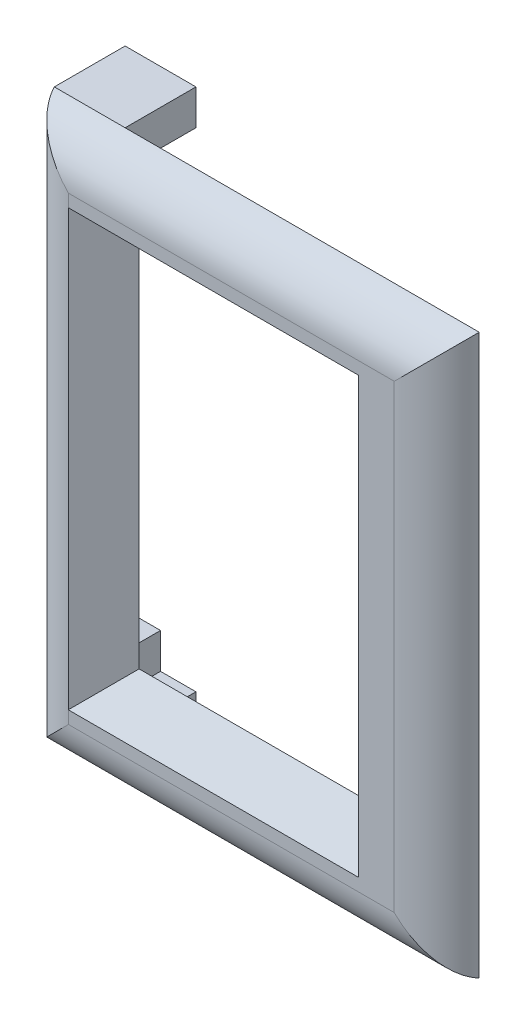
from build123d import *

# Parameters (mm, degrees)
SKETCH1_W           = 30
SKETCH1_H           = 39.485211854
BOSS_EXTRUDE1_DEPTH = 2.5
SKETCH2_W           = 14.50000216
SKETCH2_H           = 24.699998732
CUT_EXTRUDE1_DEPTH  = 37.000350752
CHAMFER2_SIZE       = 3
FILLET5_R           = 3.7
BOSS_EXTRUDE2_DEPTH = 5


with BuildPart() as part:
    # Sketch1 → Boss-Extrude1 (new body)
    with BuildSketch(Plane.XY):
        with Locations((15.000000036, -0.000120634)):
            Rectangle(SKETCH1_W, SKETCH1_H)
    extrude(amount=BOSS_EXTRUDE1_DEPTH)

    # Sketch2 → Cut-Extrude1 (cut, through all)
    with BuildSketch(Plane.XY.offset(2.5)):
        with Locations((13.737600789, -1.949e-06)):
            Rectangle(SKETCH2_W, SKETCH2_H)
    extrude(amount=-CUT_EXTRUDE1_DEPTH, mode=Mode.SUBTRACT)

    # Chamfer2
    # the kernel refuses this chamfer: 3 mm, written as the material it takes off along each edge
    with BuildSketch(Plane(origin=(20.987601869, -12.350001315, 2.5), x_dir=(0, -1, 0), z_dir=(-1, 0, 0)), Plane(origin=(6.487599709, 12.349997417, 2.5), x_dir=(0, 1, 0), z_dir=(1, 0, 0))) as chamfer2_piece_1:
        Polygon((CHAMFER2_SIZE, 0), (0, -CHAMFER2_SIZE), (0, 0), align=None)
    extrude(amount=14.500002159, mode=Mode.SUBTRACT)
    with BuildSketch(Plane(origin=(20.987601869, 12.349997417, 2.5), x_dir=(1, 0, 0), z_dir=(0, -1, 0)), Plane(origin=(6.487599709, -12.350001315, 2.5), x_dir=(-1, 0, 0), z_dir=(0, 1, 0))) as chamfer2_piece_2:
        Polygon((CHAMFER2_SIZE, 0), (0, -CHAMFER2_SIZE), (0, 0), align=None)
    extrude(amount=24.699998732, mode=Mode.SUBTRACT)
    with BuildSketch(Plane(origin=(20.987601869, 12.349997417, 2.5), x_dir=(1, 0, 0), z_dir=(0, -1, 0))) as chamfer2_piece_3a_section:
        Polygon((CHAMFER2_SIZE, 0), (0, -CHAMFER2_SIZE), (0, 0), align=None)
    chamfer2_piece_3a = extrude(amount=32.415047696, mode=Mode.PRIVATE)
    chamfer2_piece_3a = split(chamfer2_piece_3a, bisect_by=Plane(origin=(20.987601869, -12.350001315, 2.5), z_dir=(0, -1, 0)), keep=Keep.TOP, mode=Mode.PRIVATE)
    with BuildSketch(Plane(origin=(28.702650833, -12.350001315, 2.5), x_dir=(0, -1, 0), z_dir=(-1, 0, 0))) as chamfer2_piece_3b_section:
        Polygon((CHAMFER2_SIZE, 0), (0, -CHAMFER2_SIZE), (0, 0), align=None)
    chamfer2_piece_3b = extrude(amount=22.215051123, mode=Mode.PRIVATE)
    chamfer2_piece_3b = split(chamfer2_piece_3b, bisect_by=Plane(origin=(20.987601869, -12.350001315, 2.5), z_dir=(1, 0, 0)), keep=Keep.TOP, mode=Mode.PRIVATE)
    chamfer2_piece_3 = chamfer2_piece_3a & chamfer2_piece_3b
    add(chamfer2_piece_3, mode=Mode.SUBTRACT)
    with BuildSketch(Plane(origin=(20.987601869, -12.350001315, 2.5), x_dir=(0, -1, 0), z_dir=(-1, 0, 0))) as chamfer2_piece_4a_section:
        Polygon((CHAMFER2_SIZE, 0), (0, -CHAMFER2_SIZE), (0, 0), align=None)
    chamfer2_piece_4a = extrude(amount=22.215051123, mode=Mode.PRIVATE)
    chamfer2_piece_4a = split(chamfer2_piece_4a, bisect_by=Plane(origin=(6.487599709, -12.350001315, 2.5), z_dir=(-1, 0, 0)), keep=Keep.TOP, mode=Mode.PRIVATE)
    with BuildSketch(Plane(origin=(6.487599709, -20.065050279, 2.5), x_dir=(-1, 0, 0), z_dir=(0, 1, 0))) as chamfer2_piece_4b_section:
        Polygon((CHAMFER2_SIZE, 0), (0, -CHAMFER2_SIZE), (0, 0), align=None)
    chamfer2_piece_4b = extrude(amount=32.415047696, mode=Mode.PRIVATE)
    chamfer2_piece_4b = split(chamfer2_piece_4b, bisect_by=Plane(origin=(6.487599709, -12.350001315, 2.5), z_dir=(0, -1, 0)), keep=Keep.TOP, mode=Mode.PRIVATE)
    chamfer2_piece_4 = chamfer2_piece_4a & chamfer2_piece_4b
    add(chamfer2_piece_4, mode=Mode.SUBTRACT)
    with BuildSketch(Plane(origin=(6.487599709, 12.349997417, 2.5), x_dir=(0, 1, 0), z_dir=(1, 0, 0))) as chamfer2_piece_5a_section:
        Polygon((CHAMFER2_SIZE, 0), (0, -CHAMFER2_SIZE), (0, 0), align=None)
    chamfer2_piece_5a = extrude(amount=22.215051123, mode=Mode.PRIVATE)
    chamfer2_piece_5a = split(chamfer2_piece_5a, bisect_by=Plane(origin=(20.987601869, 12.349997417, 2.5), z_dir=(1, 0, 0)), keep=Keep.TOP, mode=Mode.PRIVATE)
    with BuildSketch(Plane(origin=(20.987601869, 20.065046381, 2.5), x_dir=(1, 0, 0), z_dir=(0, -1, 0))) as chamfer2_piece_5b_section:
        Polygon((CHAMFER2_SIZE, 0), (0, -CHAMFER2_SIZE), (0, 0), align=None)
    chamfer2_piece_5b = extrude(amount=32.415047696, mode=Mode.PRIVATE)
    chamfer2_piece_5b = split(chamfer2_piece_5b, bisect_by=Plane(origin=(20.987601869, 12.349997417, 2.5), z_dir=(0, 1, 0)), keep=Keep.TOP, mode=Mode.PRIVATE)
    chamfer2_piece_5 = chamfer2_piece_5a & chamfer2_piece_5b
    add(chamfer2_piece_5, mode=Mode.SUBTRACT)
    with BuildSketch(Plane(origin=(-1.227449254, 12.349997417, 2.5), x_dir=(0, 1, 0), z_dir=(1, 0, 0))) as chamfer2_piece_6a_section:
        Polygon((CHAMFER2_SIZE, 0), (0, -CHAMFER2_SIZE), (0, 0), align=None)
    chamfer2_piece_6a = extrude(amount=22.215051123, mode=Mode.PRIVATE)
    chamfer2_piece_6a = split(chamfer2_piece_6a, bisect_by=Plane(origin=(6.487599709, 12.349997417, 2.5), z_dir=(-1, 0, 0)), keep=Keep.TOP, mode=Mode.PRIVATE)
    with BuildSketch(Plane(origin=(6.487599709, -12.350001315, 2.5), x_dir=(-1, 0, 0), z_dir=(0, 1, 0))) as chamfer2_piece_6b_section:
        Polygon((CHAMFER2_SIZE, 0), (0, -CHAMFER2_SIZE), (0, 0), align=None)
    chamfer2_piece_6b = extrude(amount=32.415047696, mode=Mode.PRIVATE)
    chamfer2_piece_6b = split(chamfer2_piece_6b, bisect_by=Plane(origin=(6.487599709, 12.349997417, 2.5), z_dir=(0, 1, 0)), keep=Keep.TOP, mode=Mode.PRIVATE)
    chamfer2_piece_6 = chamfer2_piece_6a & chamfer2_piece_6b
    add(chamfer2_piece_6, mode=Mode.SUBTRACT)

    # Fillet5
    # the kernel refuses this fillet: 3.7 mm, written as the material it takes off along each edge
    with BuildSketch(Plane(origin=(-8.749999964, 19.742485293, 2.5), x_dir=(0, 0, -1), z_dir=(1, 0, 0))) as fillet5_piece_1:
        with BuildLine():
            CenterArc((3.7, -3.5), FILLET5_R, 108.924644416, 71.075355584)
            Line((0, -3.5), (0, 0))
            Line((0, 0), (2.5, 0))
        make_face()
    extrude(amount=47.5, mode=Mode.SUBTRACT)
    with BuildSketch(Plane(origin=(38.750000036, -19.742726561, 2.5), x_dir=(0, 1, 0), z_dir=(-1, 0, 0))) as fillet5_piece_2:
        with BuildLine():
            CenterArc((3.5, 3.7), FILLET5_R, 198.924644416, 71.075355584)
            Line((0, 2.5), (0, 0))
            Line((0, 0), (3.5, 0))
        make_face()
    extrude(amount=47.5, mode=Mode.SUBTRACT)
    with BuildSketch(Plane(origin=(3.6e-08, -28.492726561, 2.5), x_dir=(1, 0, 0), z_dir=(0, 1, 0)), Plane(origin=(30.000000036, 28.492485293, 2.5), x_dir=(-1, 0, 0), z_dir=(0, -1, 0))) as fillet5_piece_3:
        with BuildLine():
            CenterArc((3.5, 3.7), FILLET5_R, 198.924644416, 71.075355584)
            Line((0, 2.5), (0, 0))
            Line((0, 0), (3.5, 0))
        make_face()
    extrude(amount=56.985211855, mode=Mode.SUBTRACT)

    # Sketch5 → Boss-Extrude2 (add)
    with BuildSketch(Plane(origin=(0, 0, 0), x_dir=(-1, 0, 0), z_dir=(0, 0, -1))):
        Polygon((-3.6e-08, -19.742726561), (-5.000000036, -19.742726561), (-5.000000036, -17.242726561), (-2.5, -17.242726561), (-2.5, -14.742726561), (0, -14.742726561), align=None)
        Polygon((-2.499996996, 17.242720698), (-4.999997021, 17.242721136), (-4.999996584, 19.742721136), (3.416e-06, 19.742720261), (2.578e-06, 14.742720261), (-2.499997422, 14.742720698), align=None)
    extrude(amount=BOSS_EXTRUDE2_DEPTH)


solid = part.part
